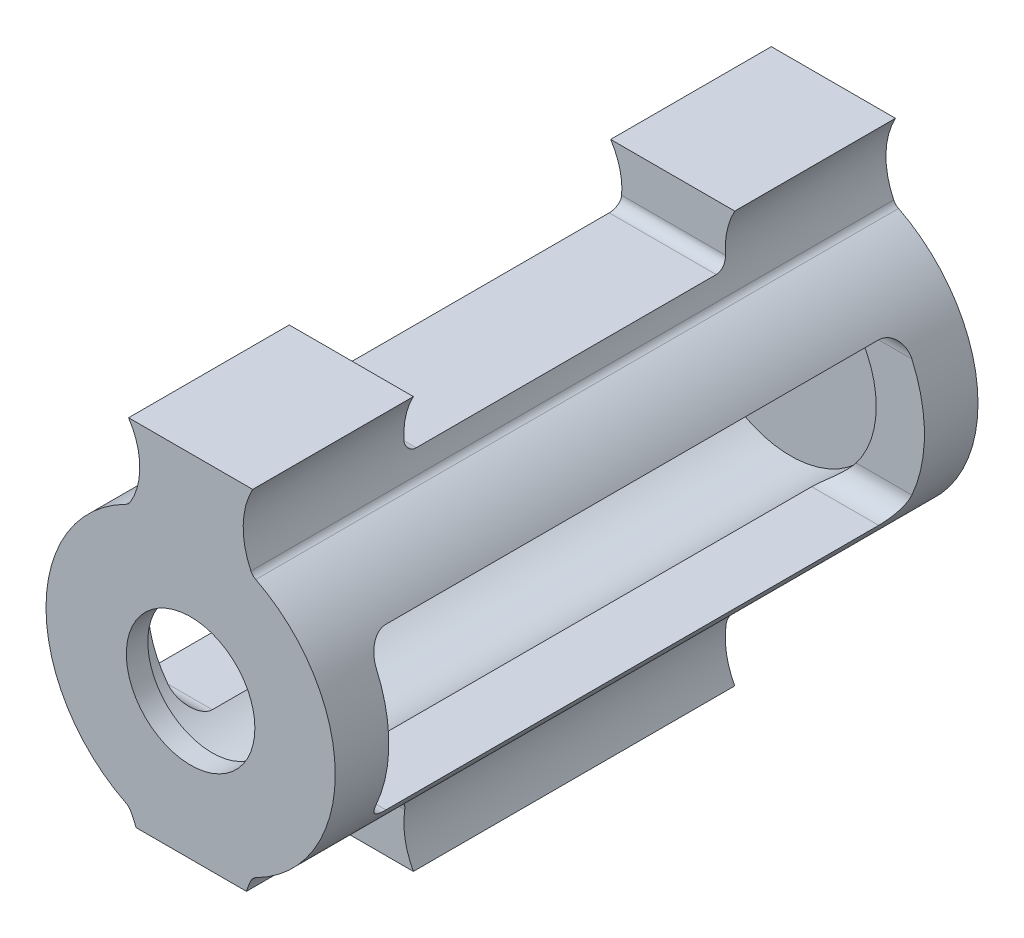
from build123d import *

# Parameters (mm, degrees)
BOSS_EXTRUDE1_DEPTH      = 139.7
BOSS_EXTRUDE1_DEPTH_BACK = 12.7
SKETCH1_R                = 22.86
CUT_EXTRUDE1_DEPTH       = 156.866098674
CUT_EXTRUDE1_DEPTH_BACK  = 156.866098674
SKETCH3_W                = 76.2
SKETCH3_H                = 12.7
SKETCH3_W_2              = 38.1
SKETCH3_H_2              = 14.224
FILLET1_R                = 2.54
FILLET2_R                = 2.54
CUT_EXTRUDE2_DEPTH       = 156.866098827
CUT_EXTRUDE2_DEPTH_BACK  = 156.866098827
SKETCH5_W                = 127
SKETCH5_H                = 38.1
FILLET3_R                = 5.08
SKETCH6_R                = 22.86
SKETCH6_R_2              = 5.08
BOSS_EXTRUDE2_DEPTH      = 10.16
BOSS_EXTRUDE3_START      = -5.08
SKETCH7_R                = 22.86
SKETCH7_R_2              = 15.24
BOSS_EXTRUDE3_DEPTH      = 5.08


with BuildPart() as part:
    # Sketch1 → Boss-Extrude1 (new, two sides: drawn at the far end of the back side and taken through both)
    with BuildSketch(Plane.XY.offset(-BOSS_EXTRUDE1_DEPTH_BACK)):
        with BuildLine():
            Line((14.712880526, 48.7531375), (-14.712880526, 48.7531375))
            ThreePointArc((-14.712880526, 48.7531375), (-12.047608415, 39.8631375), (-14.712880526, 30.9731375))
            ThreePointArc((-14.712880526, 30.9731375), (-34.29, 0), (-14.712880526, -30.9731375))
            ThreePointArc((-14.712880526, -30.9731375), (-12.047608415, -39.8631375), (-14.712880526, -48.7531375))
            Line((-14.712880526, -48.7531375), (14.712880526, -48.7531375))
            ThreePointArc((14.712880526, -48.7531375), (12.460687999, -39.8631375), (14.712880526, -30.9731375))
            ThreePointArc((14.712880526, -30.9731375), (34.29, 0), (14.712880526, 30.9731375))
            ThreePointArc((14.712880526, 30.9731375), (12.460687999, 39.8631375), (14.712880526, 48.7531375))
        make_face()
        Circle(SKETCH1_R, mode=Mode.SUBTRACT)
    extrude(amount=BOSS_EXTRUDE1_DEPTH + BOSS_EXTRUDE1_DEPTH_BACK)

    # Sketch3 → Cut-Extrude1 (cut, two sides: drawn at the far end of the back side and taken through both)
    with BuildSketch(Plane(origin=(-14.712880526, 0, 0), x_dir=(0, 0, -1), z_dir=(1, 0, 0)).offset(-CUT_EXTRUDE1_DEPTH_BACK)):
        with Locations((-63.5, 42.4031375)):
            Rectangle(SKETCH3_W, SKETCH3_H)
        with Locations((-120.65, -41.6411375)):
            Rectangle(SKETCH3_W_2, SKETCH3_H_2)
        with Locations((-6.35, -41.6411375)):
            Rectangle(SKETCH3_W_2, SKETCH3_H_2)
    extrude(amount=CUT_EXTRUDE1_DEPTH + CUT_EXTRUDE1_DEPTH_BACK, mode=Mode.SUBTRACT)

    # Fillet1
    fillet1_edges = [part.edges().sort_by_distance(p)[0] for p in [
        (0.175171158, 36.0531375, 25.4),
        (0.175171158, 36.0531375, 101.6),
        (0.142715145, -34.5291375, 101.6),
        (0.142715145, -34.5291375, 25.4),
    ]]
    fillet(fillet1_edges, radius=FILLET1_R)

    # Fillet2
    fillet2_edges = [part.edges().sort_by_distance(p)[0] for p in [
        (-14.712880526, 30.9731375, 63.5),
        (14.712880526, 30.9731375, 63.5),
        (14.712880526, -30.9731375, 63.5),
        (-14.712880526, -30.9731375, 63.5),
    ]]
    fillet(fillet2_edges, radius=FILLET2_R)

    # Sketch5 → Cut-Extrude2 (cut, two sides: drawn at the far end of the back side and taken through both)
    with BuildSketch(Plane(origin=(-14.712880526, 0, 0), x_dir=(0, 0, -1), z_dir=(1, 0, 0)).offset(-CUT_EXTRUDE2_DEPTH_BACK)):
        with Locations((-63.5, 0)):
            Rectangle(SKETCH5_W, SKETCH5_H)
    extrude(amount=CUT_EXTRUDE2_DEPTH + CUT_EXTRUDE2_DEPTH_BACK, mode=Mode.SUBTRACT)

    # Fillet3
    fillet3_edges = [part.edges().sort_by_distance(p)[0] for p in [
        (20.573884869, 19.05, 0),
        (20.573884869, 19.05, 127),
        (20.573884869, -19.05, 0),
        (20.573884869, -19.05, 127),
        (-20.573884869, -19.05, 127),
        (-20.573884869, -19.05, 0),
        (-20.573884869, 19.05, 0),
    ]]
    fillet(fillet3_edges, radius=FILLET3_R)

    # Sketch6 → Boss-Extrude2 (add)
    with BuildSketch(Plane(origin=(0, 0, -12.7), x_dir=(-1, 0, 0), z_dir=(0, 0, -1))):
        Circle(SKETCH6_R)
        Circle(SKETCH6_R_2, mode=Mode.SUBTRACT)
    extrude(amount=-BOSS_EXTRUDE2_DEPTH)

    # Sketch7 → Boss-Extrude3 (add)
    with BuildSketch(Plane.XY.offset(139.7).offset(BOSS_EXTRUDE3_START)):
        Circle(SKETCH7_R)
        Circle(SKETCH7_R_2, mode=Mode.SUBTRACT)
    extrude(amount=BOSS_EXTRUDE3_DEPTH)


solid = part.part
